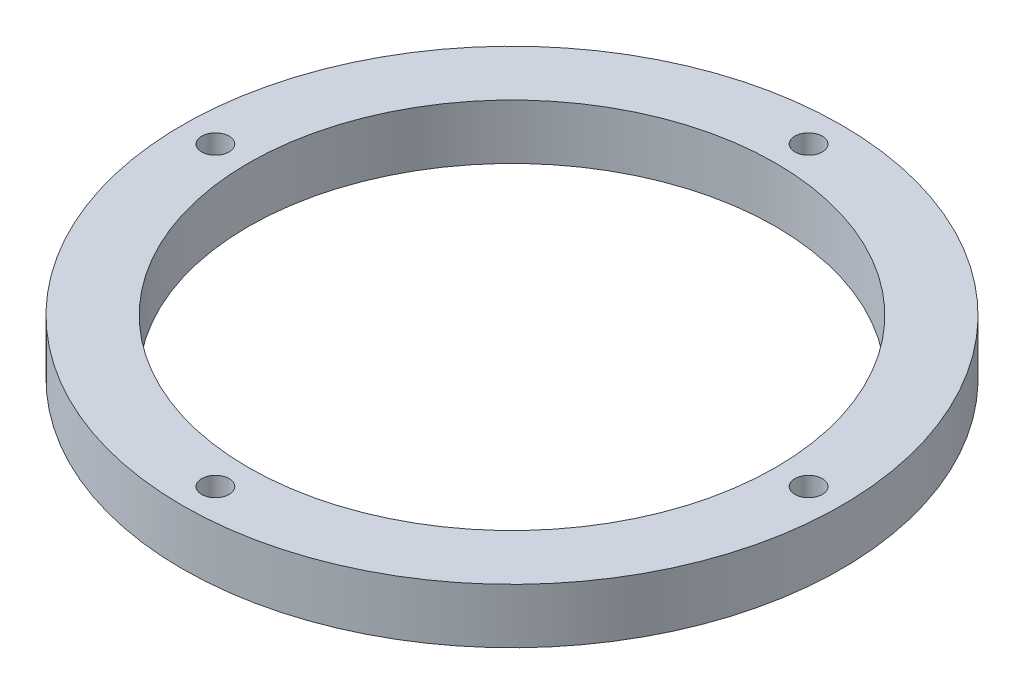
from build123d import *

# Parameters (mm, degrees)
SKETCH1_R           = 60
SKETCH1_R_2         = 48
SKETCH1_R_3         = 2.5
BOSS_EXTRUDE1_DEPTH = 10


with BuildPart() as part:
    # Sketch1 → Boss-Extrude1 (new body)
    with BuildSketch(Plane(origin=(0, 0, 0), x_dir=(1, 0, 0), z_dir=(0, 1, 0))):
        Circle(SKETCH1_R)
        Circle(SKETCH1_R_2, mode=Mode.SUBTRACT)
        with Locations((-54, 0)):
            Circle(SKETCH1_R_3, mode=Mode.SUBTRACT)
        with Locations((0, 54)):
            Circle(SKETCH1_R_3, mode=Mode.SUBTRACT)
        with Locations((54, 0)):
            Circle(SKETCH1_R_3, mode=Mode.SUBTRACT)
        with Locations((0, -54)):
            Circle(SKETCH1_R_3, mode=Mode.SUBTRACT)
    extrude(amount=BOSS_EXTRUDE1_DEPTH)


solid = part.part
